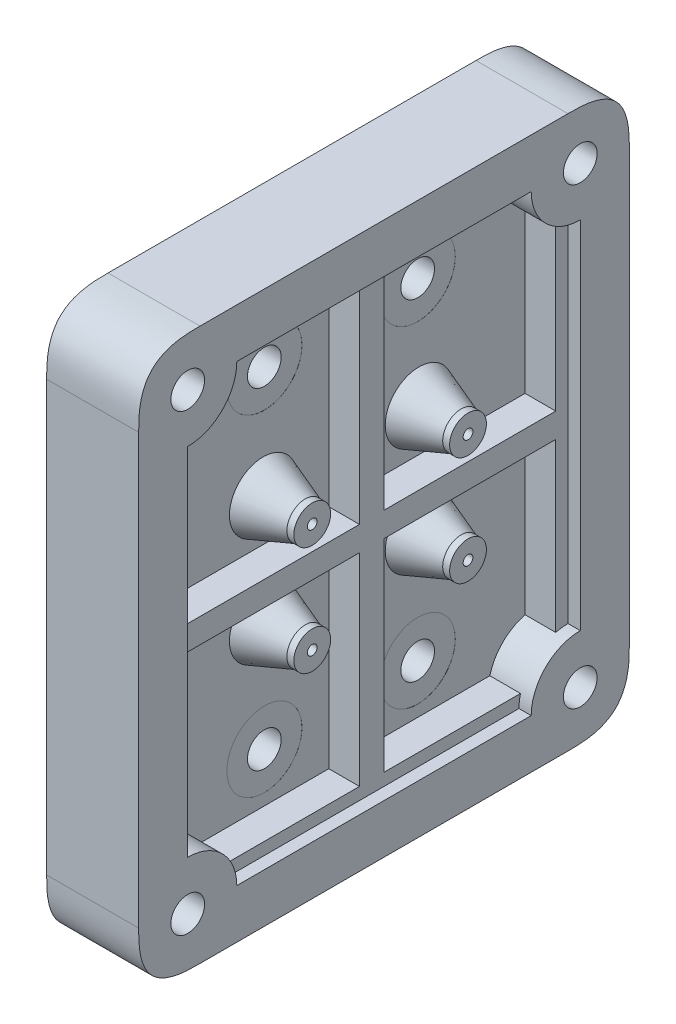
from build123d import *
from OCP.BRepFilletAPI import BRepFilletAPI_MakeChamfer

# Parameters (mm, degrees)
SKETCH1_W                                 = 80
SKETCH1_H                                 = 90
BOSS_EXTRUDE1_DEPTH                       = 8
SKETCH6_R                                 = 3
BOSS_EXTRUDE7_DEPTH                       = 8
SKETCH7_W                                 = 80
SKETCH7_H                                 = 90
SKETCH7_W_2                               = 64
SKETCH7_H_2                               = 74
BOSS_EXTRUDE2_DEPTH                       = 7
SKETCH10_W                                = 5
SKETCH10_H                                = 64
BOSS_EXTRUDE3_DEPTH                       = 2
LPATTERN1_COUNT                           = 2
LPATTERN1_PITCH                           = 37
LPATTERN1_COL_COUNT                       = 2
LPATTERN1_COL_PITCH                       = 37
CBORE_START                               = -1
CBORE_FOR_M5_HEX_HEAD_BOLT3_OUTLINE_R     = 2.75
CBORE_FOR_M5_HEX_HEAD_BOLT3_DEPTH         = 9
CBORE_START_2                             = 7.99
CBORE_FOR_M5_HEX_HEAD_BOLT3_2_OUTLINE_R   = 6.12
CBORE_FOR_M5_HEX_HEAD_BOLT3_2_OUTLINE_R_2 = 2.75
CBORE_FOR_M5_HEX_HEAD_BOLT3_2_DEPTH       = 0.01
SKETCH11_W                                = 5
SKETCH11_H                                = 74
BOSS_EXTRUDE4_DEPTH                       = 2
LPATTERN2_COUNT                           = 2
LPATTERN2_PITCH                           = 32
LPATTERN2_COL_COUNT                       = 2
LPATTERN2_COL_PITCH                       = 32
BOSS_EXTRUDE6_REACH                       = 123.347
SKETCH20_R                                = 8
CBORE_FOR_M5_HEX_HEAD_BOLT2_D             = 5.5
CBORE_FOR_M5_HEX_HEAD_BOLT2_CBORE_D       = 12.24
CBORE_FOR_M5_HEX_HEAD_BOLT2_CBORE_DEPTH   = 7
FILLET1_SIZE                              = 10
F_1_16_0_0625_DIAMETER_HOLE1_D            = 1.5875
F_1_16_0_0625_DIAMETER_HOLE1_DEPTH        = 11
F_1_16_0_0625_DIAMETER_HOLE1_TIP          = 0.476933116
CHAMFER1_SIZE                             = 2.5
CHAMFER1_SIZE2                            = 6.868693549


with BuildPart() as part:
    # Sketch1 → Boss-Extrude1 (new body)
    with BuildSketch(Plane(origin=(0, 0, 0), x_dir=(0, 0, -1), z_dir=(1, 0, 0))):
        with Locations((40, 45)):
            Rectangle(SKETCH1_W, SKETCH1_H)
    extrude(amount=BOSS_EXTRUDE1_DEPTH)

    # Sketch6 → Boss-Extrude7 (add)
    with BuildSketch(Plane(origin=(8, 0, 0), x_dir=(0, 0, -1), z_dir=(1, 0, 0))):
        with Locations(Location((27.3, 53.89, 0), (0, 0, 180))):
            Circle(SKETCH6_R)
        with Locations(Location((27.3, 36.11, 0), (0, 0, 180))):
            Circle(SKETCH6_R)
        with Locations(Location((52.7, 36.11, 0), (0, 0, 180))):
            Circle(SKETCH6_R)
        with Locations(Location((52.7, 53.89, 0), (0, 0, 180))):
            Circle(SKETCH6_R)
    extrude(amount=BOSS_EXTRUDE7_DEPTH)

    # Sketch7 → Boss-Extrude2 (add)
    with BuildSketch(Plane(origin=(8, 0, 0), x_dir=(0, 0, -1), z_dir=(1, 0, 0))):
        with Locations((40, 45)):
            Rectangle(SKETCH7_W, SKETCH7_H)
        with Locations((40, 45)):
            Rectangle(SKETCH7_W_2, SKETCH7_H_2, mode=Mode.SUBTRACT)
    extrude(amount=BOSS_EXTRUDE2_DEPTH)

    # Sketch10 → Boss-Extrude3 (add, symmetric)
    with BuildSketch(Plane(origin=(0, 45, 0), x_dir=(1, 0, 0), z_dir=(0, 1, 0))):
        with Locations((10.5, 40)):
            Rectangle(SKETCH10_W, SKETCH10_H)
    boss_extrude3 = extrude(amount=BOSS_EXTRUDE3_DEPTH, both=True)

    # LPattern1: Boss-Extrude3 ×2
    with Locations(*[(0, i * LPATTERN1_PITCH, 0) for i in range(1, LPATTERN1_COUNT)]):
        add(boss_extrude3)

    # LPattern1 col: Boss-Extrude3 ×2
    with Locations(*[(0, -i * LPATTERN1_COL_PITCH, 0) for i in range(1, LPATTERN1_COL_COUNT)]):
        add(boss_extrude3)

    # CBORE for M5 Hex Head Bolt3: read off the stored shape, not the designer's step
    # CBORE for M5 Hex Head Bolt3 outline → CBORE for M5 Hex Head Bolt3 (cut)
    with BuildSketch(Plane.YZ.offset(CBORE_START)):
        with Locations((72, -52.5)):
            Circle(CBORE_FOR_M5_HEX_HEAD_BOLT3_OUTLINE_R)
        with Locations((18, -27.5)):
            Circle(CBORE_FOR_M5_HEX_HEAD_BOLT3_OUTLINE_R)
        with Locations((18, -52.5)):
            Circle(CBORE_FOR_M5_HEX_HEAD_BOLT3_OUTLINE_R)
        with Locations((72, -27.5)):
            Circle(CBORE_FOR_M5_HEX_HEAD_BOLT3_OUTLINE_R)
    extrude(amount=CBORE_FOR_M5_HEX_HEAD_BOLT3_DEPTH, mode=Mode.SUBTRACT)

    # CBORE for M5 Hex Head Bolt3 2 outline → CBORE for M5 Hex Head Bolt3 2 (cut)
    # profile 1 of 4: a face of its own
    with BuildSketch(Plane.YZ.offset(CBORE_START_2)):
        with Locations((72, -52.5)):
            Circle(CBORE_FOR_M5_HEX_HEAD_BOLT3_2_OUTLINE_R)
        with Locations((72, -52.5)):
            Circle(CBORE_FOR_M5_HEX_HEAD_BOLT3_2_OUTLINE_R_2, mode=Mode.SUBTRACT)
    # profile 2 of 4: a face of its own
    with BuildSketch(Plane.YZ.offset(CBORE_START_2)):
        with Locations((18, -27.5)):
            Circle(CBORE_FOR_M5_HEX_HEAD_BOLT3_2_OUTLINE_R)
        with Locations((18, -27.5)):
            Circle(CBORE_FOR_M5_HEX_HEAD_BOLT3_2_OUTLINE_R_2, mode=Mode.SUBTRACT)
    # profile 3 of 4: a face of its own
    with BuildSketch(Plane.YZ.offset(CBORE_START_2)):
        with Locations((18, -52.5)):
            Circle(CBORE_FOR_M5_HEX_HEAD_BOLT3_2_OUTLINE_R)
        with Locations((18, -52.5)):
            Circle(CBORE_FOR_M5_HEX_HEAD_BOLT3_2_OUTLINE_R_2, mode=Mode.SUBTRACT)
    # profile 4 of 4: a face of its own
    with BuildSketch(Plane.YZ.offset(CBORE_START_2)):
        with Locations((72, -27.5)):
            Circle(CBORE_FOR_M5_HEX_HEAD_BOLT3_2_OUTLINE_R)
        with Locations((72, -27.5)):
            Circle(CBORE_FOR_M5_HEX_HEAD_BOLT3_2_OUTLINE_R_2, mode=Mode.SUBTRACT)
    extrude(amount=CBORE_FOR_M5_HEX_HEAD_BOLT3_2_DEPTH, mode=Mode.SUBTRACT)

    # Sketch11 → Boss-Extrude4 (add, symmetric)
    with BuildSketch(Plane(origin=(0, 0, -40), x_dir=(-1, 0, 0), z_dir=(0, 0, -1))):
        with Locations((-10.5, 45)):
            Rectangle(SKETCH11_W, SKETCH11_H)
    boss_extrude4 = extrude(amount=BOSS_EXTRUDE4_DEPTH, both=True)

    # LPattern2: Boss-Extrude4 ×2
    with Locations(*[(0, 0, i * LPATTERN2_PITCH) for i in range(1, LPATTERN2_COUNT)]):
        add(boss_extrude4)

    # LPattern2 col: Boss-Extrude4 ×2
    with Locations(*[(0, 0, -i * LPATTERN2_COL_PITCH) for i in range(1, LPATTERN2_COL_COUNT)]):
        add(boss_extrude4)

    # Sketch20 → Boss-Extrude6 (add, up to next)
    with BuildSketch(Plane(origin=(15, 0, 0), x_dir=(0, 0, -1), z_dir=(1, 0, 0)), mode=Mode.PRIVATE) as boss_extrude6_sk1:
        with Locations((8, 82)):
            Circle(SKETCH20_R)
    boss_extrude6_tool1 = extrude(boss_extrude6_sk1.sketch, amount=-BOSS_EXTRUDE6_REACH, mode=Mode.PRIVATE) - part.part
    # Sketch20 → Boss-Extrude6 (add, up to next)
    with BuildSketch(Plane(origin=(15, 0, 0), x_dir=(0, 0, -1), z_dir=(1, 0, 0)), mode=Mode.PRIVATE) as boss_extrude6_sk2:
        with Locations((72, 82)):
            Circle(SKETCH20_R)
    boss_extrude6_tool2 = extrude(boss_extrude6_sk2.sketch, amount=-BOSS_EXTRUDE6_REACH, mode=Mode.PRIVATE) - part.part
    # Sketch20 → Boss-Extrude6 (add, up to next)
    with BuildSketch(Plane(origin=(15, 0, 0), x_dir=(0, 0, -1), z_dir=(1, 0, 0)), mode=Mode.PRIVATE) as boss_extrude6_sk3:
        with Locations((8, 8)):
            Circle(SKETCH20_R)
    boss_extrude6_tool3 = extrude(boss_extrude6_sk3.sketch, amount=-BOSS_EXTRUDE6_REACH, mode=Mode.PRIVATE) - part.part
    # Sketch20 → Boss-Extrude6 (add, up to next)
    with BuildSketch(Plane(origin=(15, 0, 0), x_dir=(0, 0, -1), z_dir=(1, 0, 0)), mode=Mode.PRIVATE) as boss_extrude6_sk4:
        with Locations((72, 8)):
            Circle(SKETCH20_R)
    boss_extrude6_tool4 = extrude(boss_extrude6_sk4.sketch, amount=-BOSS_EXTRUDE6_REACH, mode=Mode.PRIVATE) - part.part
    add(boss_extrude6_tool1.solids().sort_by_distance((15, 82, -8))[0])
    add(boss_extrude6_tool2.solids().sort_by_distance((15, 82, -72))[0])
    add(boss_extrude6_tool3.solids().sort_by_distance((15, 8, -8))[0])
    add(boss_extrude6_tool4.solids().sort_by_distance((15, 8, -72))[0])

    # CBORE for M5 Hex Head Bolt2 (through all)
    with Locations(Plane.ZY):
        with Locations((-8, 82), (-72, 82), (-8, 8), (-72, 8)):
            CounterBoreHole(CBORE_FOR_M5_HEX_HEAD_BOLT2_D / 2, CBORE_FOR_M5_HEX_HEAD_BOLT2_CBORE_D / 2, CBORE_FOR_M5_HEX_HEAD_BOLT2_CBORE_DEPTH)

    # Fillet1
    # a fillet whose section is not a circle: 10 mm, written as the material it takes off along each edge
    with BuildSketch(Plane(origin=(-25, 0, -80), x_dir=(0, 0, 1), z_dir=(1, 0, 0)), Plane(origin=(40, 0, 0), x_dir=(0, 0, -1), z_dir=(-1, 0, 0)), Plane(origin=(40, 90, 0), x_dir=(0, -1, 0), z_dir=(-1, 0, 0)), Plane(origin=(-25, 90, -80), x_dir=(0, -1, 0), z_dir=(1, 0, 0))) as fillet1_piece_1:
        with BuildLine():
            add(Edge.make_bspline([(FILLET1_SIZE, 0), (FILLET1_SIZE * 0.831801948466, 0), (FILLET1_SIZE * 0.663603896932, 0), (FILLET1_SIZE * 0.292893218813, -FILLET1_SIZE * 0.0716919198361), (FILLET1_SIZE * 0.0716919198361, -FILLET1_SIZE * 0.292893218813), (0, -FILLET1_SIZE * 0.663603896932), (0, -FILLET1_SIZE * 0.831801948466), (0, -FILLET1_SIZE)], knots=[0, 0, 0, 0, 0, 0, 0.5, 0.5, 1, 1, 1, 1, 1, 1], degree=5))
            Line((0, -FILLET1_SIZE), (0, 0))
            Line((0, 0), (FILLET1_SIZE, 0))
        make_face()
    extrude(amount=65, mode=Mode.SUBTRACT)

    # 1/16 (0.0625) Diameter Hole1
    with Locations(Plane(origin=(16, 0, 0), x_dir=(0, 0, -1), z_dir=(1, 0, 0))):
        with Locations((27.3, 53.89), (52.7, 53.89), (52.7, 36.11), (27.3, 36.11)):
            Hole(F_1_16_0_0625_DIAMETER_HOLE1_D / 2, depth=F_1_16_0_0625_DIAMETER_HOLE1_DEPTH)
            with Locations((0, 0, -(F_1_16_0_0625_DIAMETER_HOLE1_DEPTH + F_1_16_0_0625_DIAMETER_HOLE1_TIP / 2))):  # 118° drill point
                Cone(0, F_1_16_0_0625_DIAMETER_HOLE1_D / 2, F_1_16_0_0625_DIAMETER_HOLE1_TIP, mode=Mode.SUBTRACT)

    # Chamfer1: one chamfer whose edges measure the first distance from different faces: ONE call of the kernel's chamfer builder (chamfer() names one face for all edges)
    chamfer1_edges_1 = [part.edges().sort_by_distance(p)[0] for p in [
        (8, 53.89, -30.3),
    ]]
    chamfer1_side_1 = [part.faces().sort_by_distance(p)[0] for p in [
        (8, 62.109672107, -23.682631382),
    ]]
    chamfer1_edges_2 = [part.edges().sort_by_distance(p)[0] for p in [
        (8, 36.11, -30.3),
    ]]
    chamfer1_side_2 = [part.faces().sort_by_distance(p)[0] for p in [
        (8, 27.890327893, -23.682631382),
    ]]
    chamfer1_edges_3 = [part.edges().sort_by_distance(p)[0] for p in [
        (8, 36.11, -55.7),
    ]]
    chamfer1_side_3 = [part.faces().sort_by_distance(p)[0] for p in [
        (8, 27.890327893, -56.317368618),
    ]]
    chamfer1_edges_4 = [part.edges().sort_by_distance(p)[0] for p in [
        (8, 53.89, -55.7),
    ]]
    chamfer1_side_4 = [part.faces().sort_by_distance(p)[0] for p in [
        (8, 62.109672107, -56.317368618),
    ]]
    chamfer1 = BRepFilletAPI_MakeChamfer(part.part.solid().wrapped)
    for e in chamfer1_edges_1:
        chamfer1.Add(CHAMFER1_SIZE, CHAMFER1_SIZE2, e.wrapped, chamfer1_side_1[0].wrapped)  # the first distance lies on this face
    for e in chamfer1_edges_2:
        chamfer1.Add(CHAMFER1_SIZE, CHAMFER1_SIZE2, e.wrapped, chamfer1_side_2[0].wrapped)  # the first distance lies on this face
    for e in chamfer1_edges_3:
        chamfer1.Add(CHAMFER1_SIZE, CHAMFER1_SIZE2, e.wrapped, chamfer1_side_3[0].wrapped)  # the first distance lies on this face
    for e in chamfer1_edges_4:
        chamfer1.Add(CHAMFER1_SIZE, CHAMFER1_SIZE2, e.wrapped, chamfer1_side_4[0].wrapped)  # the first distance lies on this face
    add(Compound.cast(chamfer1.Shape()), mode=Mode.REPLACE)


solid = part.part
